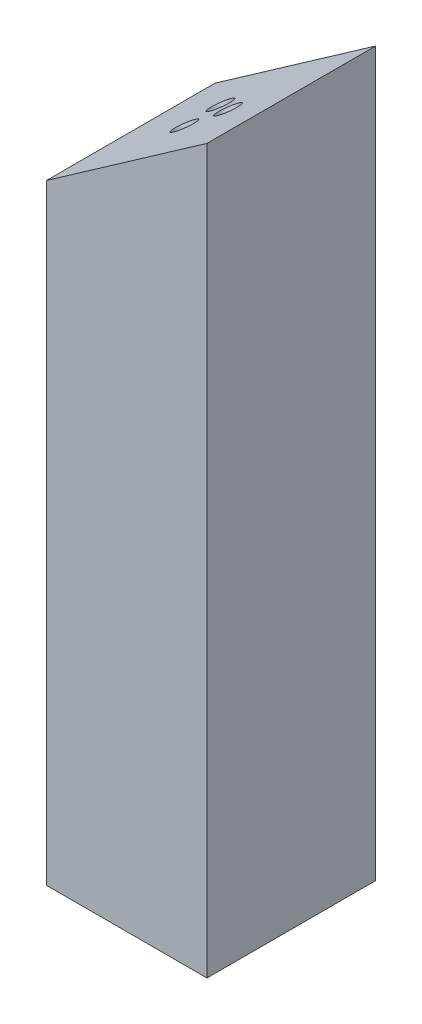
from build123d import *

# Parameters (mm, degrees)
SKETCH1_W           = 100
SKETCH1_H           = 105
BOSS_EXTRUDE1_DEPTH = 350
SKETCH2_W           = 100
SKETCH2_H           = 105
BOSS_EXTRUDE2_DEPTH = 100
CUT_EXTRUDE1_REACH  = 466.785
SHELL1_T            = -5
CUT_EXTRUDE2_REACH  = 376.584
SKETCH4_R           = 7
CUT_EXTRUDE3_REACH  = 465.957
SKETCH5_W           = 70
SKETCH5_H           = 16
FILLET1_R           = 8


with BuildPart() as part:
    # Sketch1 → Boss-Extrude1 (new body)
    with BuildSketch(Plane(origin=(0, 0, 0), x_dir=(1, 0, 0), z_dir=(0, 1, 0))):
        Rectangle(SKETCH1_W, SKETCH1_H)
    extrude(amount=BOSS_EXTRUDE1_DEPTH)

    # Sketch2 → Boss-Extrude2 (add)
    with BuildSketch(Plane(origin=(0, 350, 0), x_dir=(1, 0, 0), z_dir=(0, 1, 0))):
        Rectangle(SKETCH2_W, SKETCH2_H)
    extrude(amount=BOSS_EXTRUDE2_DEPTH)

    # Sketch3 → Cut-Extrude1 (cut, up to next)
    with BuildSketch(Plane.XY.offset(52.5), mode=Mode.PRIVATE) as cut_extrude1_sk1:
        Polygon((-50, 450), (50, 450), (-50, 379.979246179), align=None)
    cut_extrude1_tool1 = extrude(cut_extrude1_sk1.sketch, amount=-CUT_EXTRUDE1_REACH, mode=Mode.PRIVATE) & part.part
    add(cut_extrude1_tool1.solids().sort_by_distance((-16.666667, 426.659749, 52.5))[0], mode=Mode.SUBTRACT)

    # Shell1
    shell1_openings = [part.faces().sort_by_distance(p)[0] for p in [
        (0, 0, 0),
    ]]
    offset(amount=SHELL1_T, openings=shell1_openings, kind=Kind.INTERSECTION)

    # Sketch4 → Cut-Extrude2 (cut, up to next)
    with BuildSketch(Plane(origin=(-194.98134326, 278.462216729, 0), x_dir=(0.8191520442889949, 0.5735764363510417, 0), z_dir=(-0.5735764363510417, 0.819152044288995, 0)), mode=Mode.PRIVATE) as cut_extrude2_sk1:
        with Locations(Location((251.028269134, 0, 0), (0, 0, 180))):
            Circle(SKETCH4_R)
    cut_extrude2_tool1 = extrude(cut_extrude2_sk1.sketch, amount=-CUT_EXTRUDE2_REACH, mode=Mode.PRIVATE) & part.part
    # Sketch4 → Cut-Extrude2 (cut, up to next)
    with BuildSketch(Plane(origin=(-194.98134326, 278.462216729, 0), x_dir=(0.8191520442889949, 0.5735764363510417, 0), z_dir=(-0.5735764363510417, 0.819152044288995, 0)), mode=Mode.PRIVATE) as cut_extrude2_sk2:
        with Locations(Location((231.528269134, -11.258330249, 0), (0, 0, 180))):
            Circle(SKETCH4_R)
    cut_extrude2_tool2 = extrude(cut_extrude2_sk2.sketch, amount=-CUT_EXTRUDE2_REACH, mode=Mode.PRIVATE) & part.part
    # Sketch4 → Cut-Extrude2 (cut, up to next)
    with BuildSketch(Plane(origin=(-194.98134326, 278.462216729, 0), x_dir=(0.8191520442889949, 0.5735764363510417, 0), z_dir=(-0.5735764363510417, 0.819152044288995, 0)), mode=Mode.PRIVATE) as cut_extrude2_sk3:
        with Locations(Location((231.528269134, 11.258330249, 0), (0, 0, 180))):
            Circle(SKETCH4_R)
    cut_extrude2_tool3 = extrude(cut_extrude2_sk3.sketch, amount=-CUT_EXTRUDE2_REACH, mode=Mode.PRIVATE) & part.part
    add(cut_extrude2_tool1.solids().sort_by_distance((10.648977, 422.446117, 0))[0], mode=Mode.SUBTRACT)
    add(cut_extrude2_tool2.solids().sort_by_distance((-5.324488, 411.261376, 11.25833))[0], mode=Mode.SUBTRACT)
    add(cut_extrude2_tool3.solids().sort_by_distance((-5.324488, 411.261376, -11.25833))[0], mode=Mode.SUBTRACT)

    # Sketch5 → Cut-Extrude3 (cut, up to next)
    with BuildSketch(Plane.ZY.offset(50), mode=Mode.PRIVATE) as cut_extrude3_sk1:
        with Locations((0, 361.979246179)):
            Rectangle(SKETCH5_W, SKETCH5_H)
    cut_extrude3_tool1 = extrude(cut_extrude3_sk1.sketch, amount=-CUT_EXTRUDE3_REACH, mode=Mode.PRIVATE) & part.part
    add(cut_extrude3_tool1.solids().sort_by_distance((-50, 361.979246, 0))[0], mode=Mode.SUBTRACT)

    # Fillet1
    fillet1_edges = [part.edges().sort_by_distance(p)[0] for p in [
        (-47.5, 353.979246179, 35),
        (-47.5, 369.979246179, 35),
        (-47.5, 353.979246179, -35),
        (-47.5, 369.979246179, -35),
    ]]
    fillet(fillet1_edges, radius=FILLET1_R - 0.0001)  # a hair under: the kernel refuses the full size


solid = part.part
